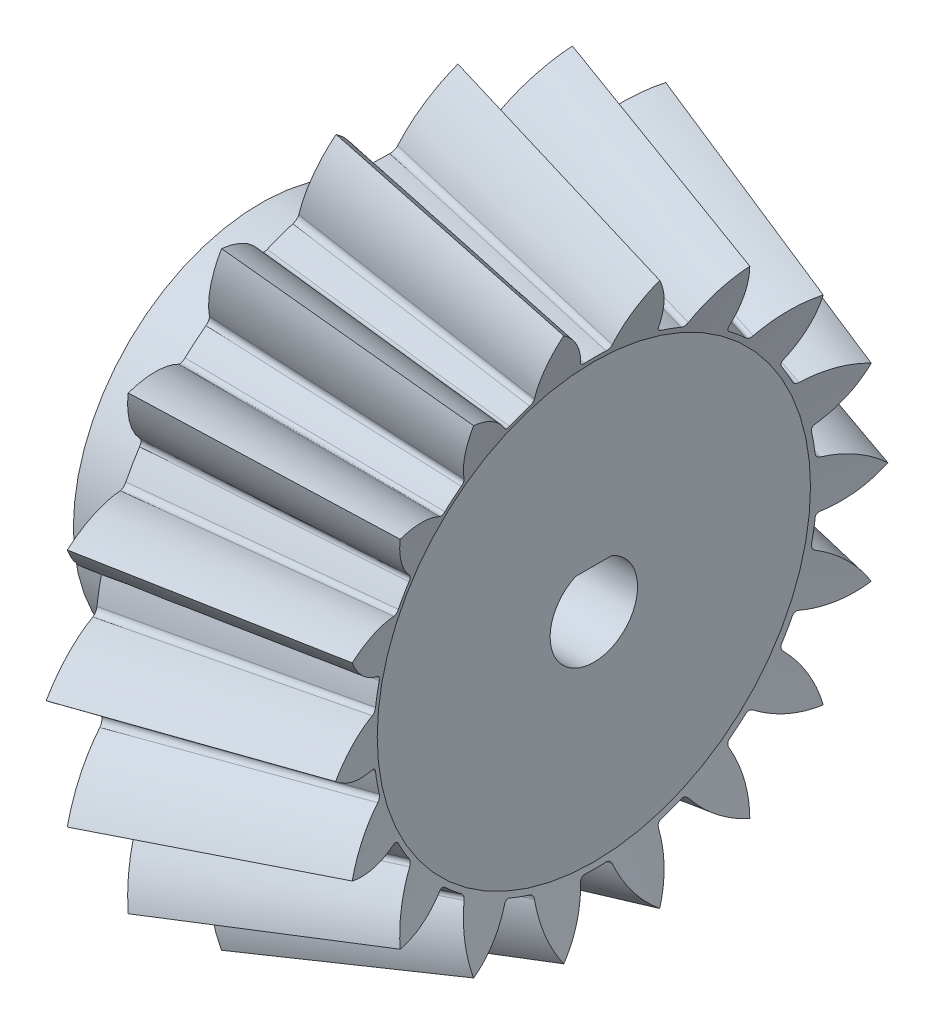
from build123d import *

# Parameters (mm, degrees)
TEETHCUTS_COUNT         = 18
TEETHCUTS_ANGLE         = 340
HUBSKE_R                = 24.235234428
HUB_DEPTH               = 0.0001016
BORSKE_R                = 4.5
BORE_DEPTH              = 90.829480472
SKETCH1_R               = 16.5
SKETCH1_R_2             = 3.85
BOSS_EXTRUDE1_DEPTH     = 10
SKETCH2_R               = 4.5
SKETCH2_R_2             = 3.85
BOSS_EXTRUDE2_DEPTH     = 29.333171645
BOSS_EXTRUDE3_START     = -29.333171645
SKETCH3_R               = 12.5
BOSS_EXTRUDE3_DEPTH     = 29.333171645
CUT_EXTRUDE1_DEPTH      = 51.422024031
CUT_EXTRUDE1_DEPTH_BACK = 51.422024031
SKETCH5_R               = 1.475


with BuildPart() as part:
    # BasProSke → Base-Revolve (revolve)
    with BuildSketch(Plane(origin=(0, 0, 0), x_dir=(1, 0, 0), z_dir=(0, 1, 0)), mode=Mode.PRIVATE) as base_revolve_sk:
        Polygon((0, 0), (0, 24.235234428), (2.052324805, 31.076317104), (20.948556929, 24.461714126), (19.333070045, 19.076757853), (19.333070045, 0), align=None)
    revolve(base_revolve_sk.sketch.rotate(Axis((-10, 0, 0), (1, 0, 0)), 180), axis=Axis((-10, 0, 0), (1, 0, 0)))

    # ToothCut: read off the stored shape, not the designer's step
    # ToothCut: loft between two sections, ruled curve by curve
    toothcut_from = [
        Edge.make_bspline([(90.831451549, 0.006739589, -0.010572583), (90.829851323, 0.001405501, -0.014278886), (90.827946016, -0.004945521, -0.013393313), (90.826681369, -0.009161012, -0.008355435)], [0, 0, 0, 0, 1, 1, 1, 1], 3, [1, 0.834542954, 0.834542954, 1]),
        Edge.make_bspline([(90.826681369, -0.009161012, 0.008355435), (90.827946016, -0.004945521, 0.013393313), (90.829851323, 0.001405501, 0.014278886), (90.831451549, 0.006739589, 0.010572583)], [0, 0, 0, 0, 1, 1, 1, 1], 3, [1, 0.834542954, 0.834542954, 1]),
        Edge.make_bspline([(90.826681369, -0.009161012, -0.008355435), (90.826471086, -0.009861956, -0.007517746), (90.826294047, -0.010452085, -0.006591641), (90.826153287, -0.010921285, -0.00559299)], [0, 0, 0, 0, 1, 1, 1, 1], 3, [1, 0.994287775, 0.994287775, 1]),
        Edge.make_bspline([(90.826153287, -0.010921285, 0.00559299), (90.826294047, -0.010452085, 0.006591641), (90.826471086, -0.009861956, 0.007517746), (90.826681369, -0.009161012, 0.008355435)], [0, 0, 0, 0, 1, 1, 1, 1], 3, [1, 0.994287775, 0.994287775, 1]),
        Edge.make_bspline([(90.826153287, -0.010921285, -0.00559299), (90.825646943, -0.012609099, -0.002000633), (90.825646943, -0.012609099, 0.002000633), (90.826153287, -0.010921285, 0.00559299)], [0, 0, 0, 0, 1, 1, 1, 1], 3, [1, 0.931870089, 0.931870089, 1]),
        Edge.make_line((90.831451549, 0.006739589, 0.010572583), (90.831451549, 0.006739589, -0.010572583)),
    ]
    toothcut_to = [
        Edge.make_bspline([(2.054411993, 31.083274396, -6.246091394), (1.633577265, 29.680491971, -4.02678121), (1.014522194, 27.616975072, -2.468286127), (0.277146671, 25.159056665, -1.771757207)], [0, 0, 0, 0, 1, 1, 1, 1], 3, [1, 0.9569775, 0.9569775, 1]),
        Edge.make_bspline([(0.277146671, 25.159056665, 1.771757207), (1.014522194, 27.616975072, 2.468286127), (1.633577265, 29.680491971, 4.02678121), (2.054411993, 31.083274396, 6.246091394)], [0, 0, 0, 0, 1, 1, 1, 1], 3, [1, 0.9569775, 0.9569775, 1]),
        Edge.make_bspline([(0.277146671, 25.159056665, -1.771757207), (0.20040839, 24.903262395, -1.699269811), (0.153653576, 24.747413015, -1.475442079), (0.157515023, 24.760284503, -1.199048684)], [0, 0, 0, 0, 1, 1, 1, 1], 3, [1, 0.852900756, 0.852900756, 1]),
        Edge.make_bspline([(0.157515023, 24.760284503, 1.199048684), (0.153653576, 24.747413015, 1.475442079), (0.20040839, 24.903262395, 1.699269811), (0.277146671, 25.159056665, 1.771757207)], [0, 0, 0, 0, 1, 1, 1, 1], 3, [1, 0.852900756, 0.852900756, 1]),
        Edge.make_bspline([(0.157515023, 24.760284503, -1.199048684), (0.168678435, 24.797495877, -0.399997521), (0.168678435, 24.797495877, 0.399997521), (0.157515023, 24.760284503, 1.199048684)], [0, 0, 0, 0, 1, 1, 1, 1], 3, [1, 0.999213428, 0.999213428, 1]),
        Edge.make_line((2.054411993, 31.083274396, 6.246091394), (2.054411993, 31.083274396, -6.246091394)),
    ]
    toothcut = Solid(Shell([*[Face.make_surface_from_curves(toothcut_from[k], toothcut_to[k]) for k in range(6)], Face(Wire(toothcut_from)), Face(Wire(toothcut_to))]))
    add(toothcut, mode=Mode.SUBTRACT)

    # TeethCuts: ToothCut ×18 about axis
    teethcuts_axis = Axis((-10, 0, 0), (1, 0, 0))
    for i in range(1, TEETHCUTS_COUNT):
        add(toothcut.rotate(teethcuts_axis, i * TEETHCUTS_ANGLE / (TEETHCUTS_COUNT - 1)), mode=Mode.SUBTRACT)

    # HubSke → Hub (add)
    with BuildSketch(Plane.ZY):
        Circle(HUBSKE_R)
    extrude(amount=HUB_DEPTH)

    # BorSke → Bore (cut, symmetric)
    with BuildSketch(Plane(origin=(0, 0, 0), x_dir=(0, 0, -1), z_dir=(1, 0, 0))):
        with Locations(Location((0, 0, 0), (0, 0, 180))):
            Circle(BORSKE_R)
    extrude(amount=BORE_DEPTH, both=True, mode=Mode.SUBTRACT)

    # Sketch1 → Boss-Extrude1 (add)
    with BuildSketch(Plane.ZY.offset(0.0001016)):
        Circle(SKETCH1_R)
        Circle(SKETCH1_R_2, mode=Mode.SUBTRACT)
    extrude(amount=BOSS_EXTRUDE1_DEPTH)

    # Sketch2 → Boss-Extrude2 (add)
    with BuildSketch(Plane(origin=(19.333070045, 0, 0), x_dir=(0, 0, -1), z_dir=(1, 0, 0))):
        Circle(SKETCH2_R)
        Circle(SKETCH2_R_2, mode=Mode.SUBTRACT)
    extrude(amount=-BOSS_EXTRUDE2_DEPTH)

    # Sketch3 → Boss-Extrude3 (add)
    with BuildSketch(Plane.ZY.offset(10.0001016).offset(BOSS_EXTRUDE3_START)):
        Circle(SKETCH3_R)
        with BuildLine():
            Line((1.603901493, 3.5), (-1.603901493, 3.5))
            ThreePointArc((-1.603901493, 3.5), (0, -3.85), (1.603901493, 3.5))
        make_face(mode=Mode.SUBTRACT)
    extrude(amount=BOSS_EXTRUDE3_DEPTH)

    # Sketch5 → Cut-Extrude1 (cut, two sides: drawn at the far end of the back side and taken through both)
    with BuildSketch(Plane(origin=(0, 3.5, 0), x_dir=(-1, 0, 0), z_dir=(0, -1, 0)).offset(-CUT_EXTRUDE1_DEPTH_BACK)):
        with Locations(Location((3.592594918, 0, 0), (0, 0, 90))):
            Circle(SKETCH5_R)
    extrude(amount=CUT_EXTRUDE1_DEPTH + CUT_EXTRUDE1_DEPTH_BACK, mode=Mode.SUBTRACT)


solid = part.part
